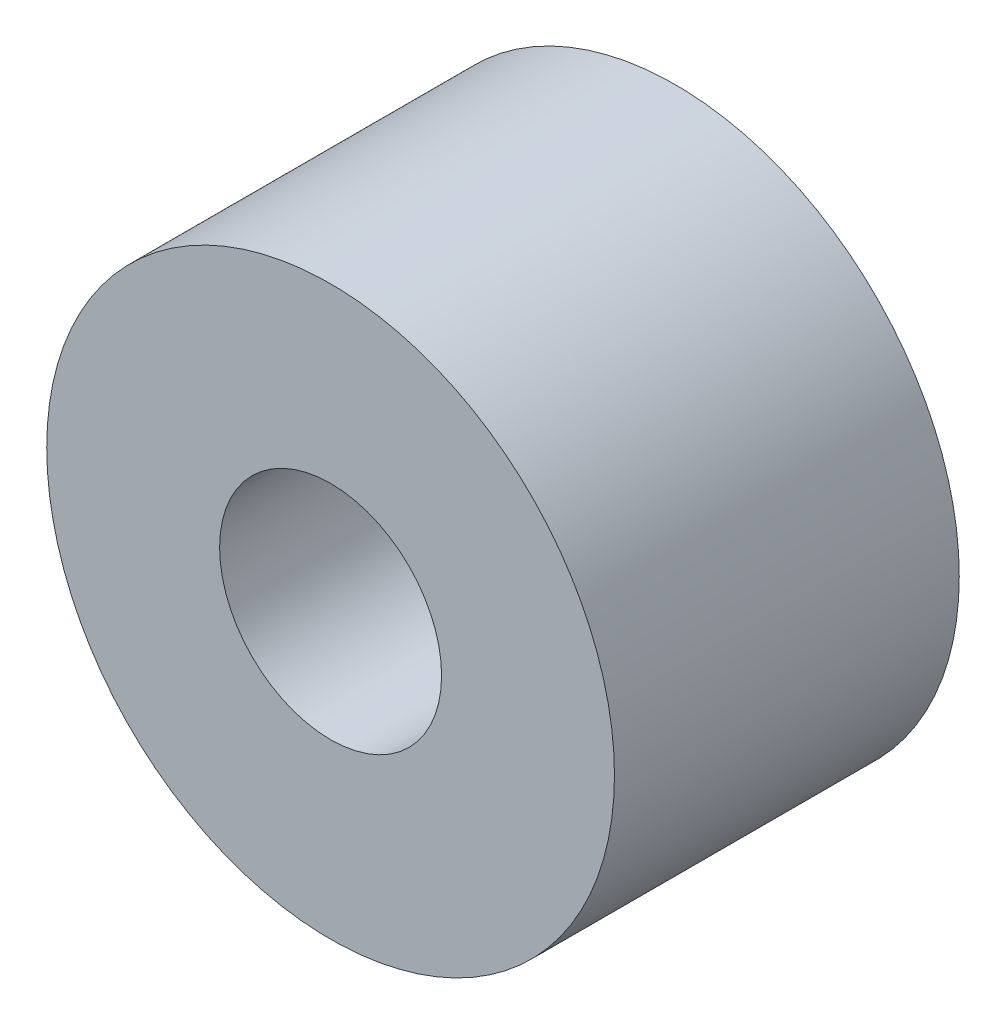
from build123d import *

# Parameters (mm, degrees)
SKETCH1_R           = 4.775
SKETCH1_R_2         = 1.8669
BOSS_EXTRUDE1_DEPTH = 5.8


with BuildPart() as part:
    # Sketch1 → Boss-Extrude1 (new body)
    with BuildSketch(Plane.XY):
        Circle(SKETCH1_R)
        Circle(SKETCH1_R_2, mode=Mode.SUBTRACT)
    extrude(amount=BOSS_EXTRUDE1_DEPTH)


solid = part.part
